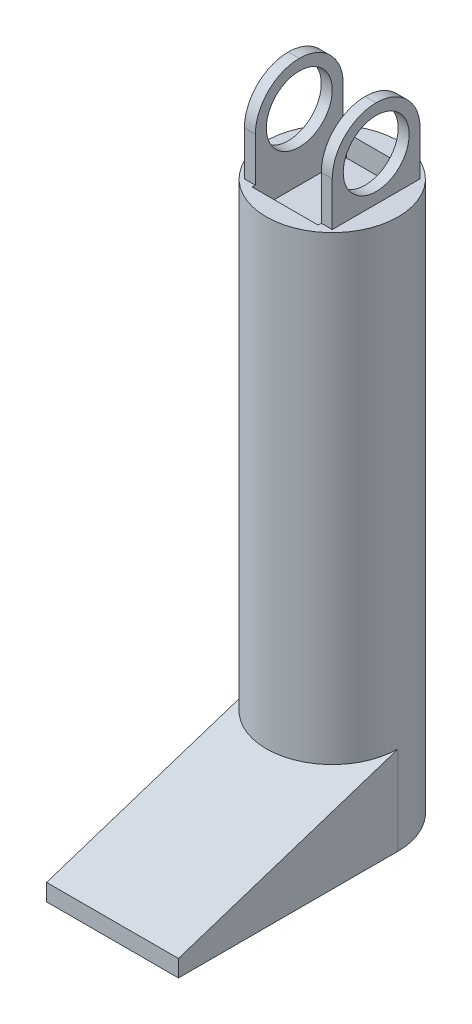
from build123d import *

# Parameters (mm, degrees)
SKETCH1_R           = 3
BOSS_EXTRUDE1_DEPTH = 25
SKETCH2_W           = 4
SKETCH2_H           = 4
SKETCH2_W_2         = 3
SKETCH2_H_2         = 3
BOSS_EXTRUDE2_DEPTH = 4
SKETCH3_W           = 3
SKETCH3_H           = 4.288213466
CUT_EXTRUDE1_DEPTH  = 5
SKETCH4_R           = 1.5
CUT_EXTRUDE2_DEPTH  = 5
FILLET1_R           = 2
SKETCH5_W           = 6
SKETCH5_H           = 4.032898641
BOSS_EXTRUDE3_DEPTH = 10
CUT_EXTRUDE4_DEPTH  = 10


with BuildPart() as part:
    # Sketch1 → Boss-Extrude1 (new body)
    with BuildSketch(Plane(origin=(0, 0, 0), x_dir=(1, 0, 0), z_dir=(0, 1, 0))):
        with Locations(Location((0, 0, 0), (0, 0, 270))):
            Circle(SKETCH1_R)
    extrude(amount=BOSS_EXTRUDE1_DEPTH)

    # Sketch2 → Boss-Extrude2 (add)
    with BuildSketch(Plane(origin=(0, 25, 0), x_dir=(1, 0, 0), z_dir=(0, 1, 0))):
        Rectangle(SKETCH2_W, SKETCH2_H)
        Rectangle(SKETCH2_W_2, SKETCH2_H_2, mode=Mode.SUBTRACT)
    extrude(amount=BOSS_EXTRUDE2_DEPTH)

    # Sketch3 → Cut-Extrude1 (cut)
    with BuildSketch(Plane(origin=(0, 29, 0), x_dir=(1, 0, 0), z_dir=(0, 1, 0))):
        Rectangle(SKETCH3_W, SKETCH3_H)
    extrude(amount=-CUT_EXTRUDE1_DEPTH, mode=Mode.SUBTRACT)

    # Sketch4 → Cut-Extrude2 (cut)
    with BuildSketch(Plane.ZY.offset(2)):
        with Locations((0, 27)):
            Circle(SKETCH4_R)
    extrude(amount=-CUT_EXTRUDE2_DEPTH, mode=Mode.SUBTRACT)

    # Fillet1
    fillet1_edges = [part.edges().sort_by_distance(p)[0] for p in [
        (1.75, 29, 2),
        (1.75, 29, -2),
        (-1.75, 29, -2),
        (-1.75, 29, 2),
    ]]
    fillet(fillet1_edges, radius=FILLET1_R - 0.0001)  # a hair under: the kernel refuses the full size

    # Sketch5 → Boss-Extrude3 (add)
    with BuildSketch(Plane.XY):
        with Locations((0, 2.016449321)):
            Rectangle(SKETCH5_W, SKETCH5_H)
    extrude(amount=BOSS_EXTRUDE3_DEPTH)

    # Sketch6 → Cut-Extrude4 (cut)
    with BuildSketch(Plane.ZY.offset(3)):
        Polygon((0, 4.032898641), (10, 0.769169486), (10, 4.032898641), align=None)
    extrude(amount=-CUT_EXTRUDE4_DEPTH, mode=Mode.SUBTRACT)


solid = part.part
